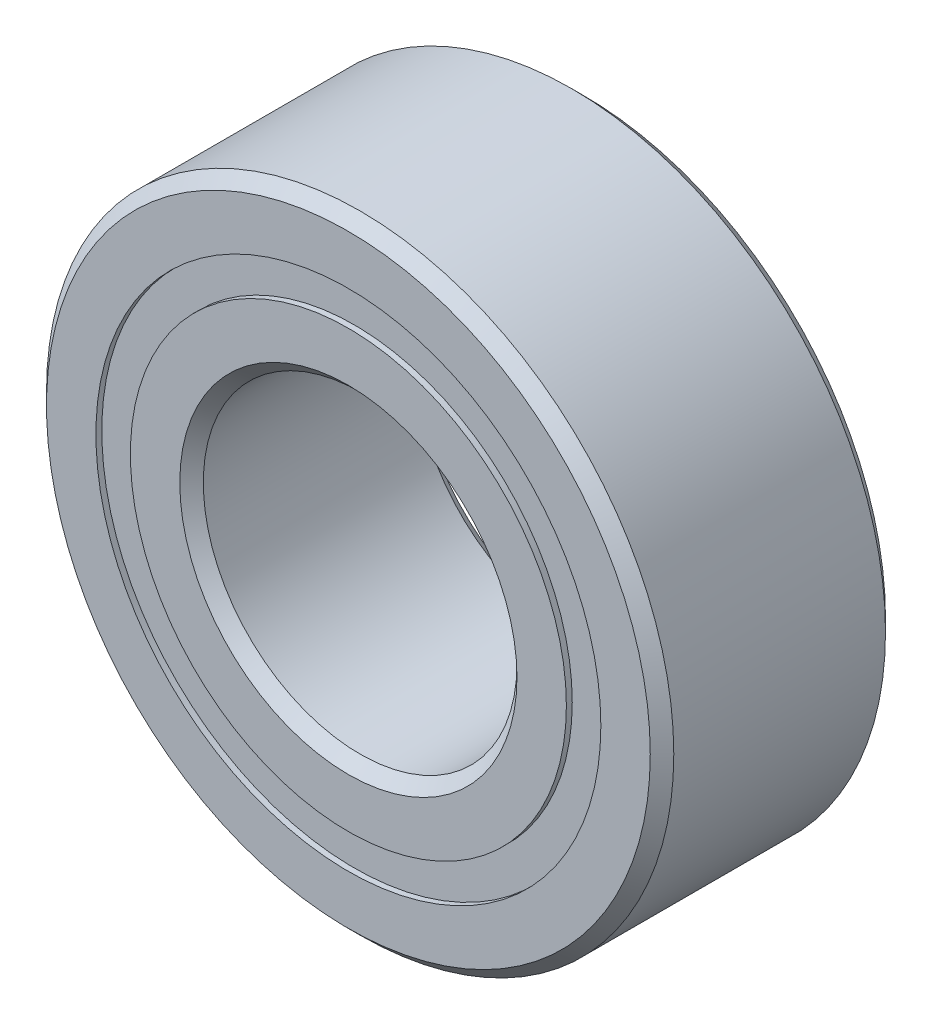
from build123d import *

# Parameters (mm, degrees)
CIRPATTERN1_COUNT = 12
SKETCH5_W         = 1.147826059
SKETCH5_H         = 0.697802198


with BuildPart() as part:
    # Sketch1 → Revolve1 (revolve)
    with BuildSketch(Plane(origin=(0, 0, 0), x_dir=(0, 0, -1), z_dir=(1, 0, 0))):
        with BuildLine():
            Line((2.143125, 6.35), (-2.143125, 6.35))
            Line((-2.143125, 6.35), (-2.38125, 6.111875))
            Line((-2.38125, 6.111875), (-2.38125, 5.111401099))
            Line((-2.38125, 5.111401099), (-1.058333333, 5.111401099))
            ThreePointArc((-1.058333333, 5.111401099), (0, 5.876861441), (1.058333333, 5.111401099))
            Line((1.058333333, 5.111401099), (2.38125, 5.111401099))
            Line((2.38125, 5.111401099), (2.38125, 6.111875))
            Line((2.38125, 6.111875), (2.143125, 6.35))
        make_face()
    revolve(axis=Axis((0, 0, 2.38125), (0, 0, -1)))


with BuildPart() as body_2:
    # Sketch3 → Revolve3 (revolve)
    with BuildSketch(Plane(origin=(0, 0, 0), x_dir=(0, 0, -1), z_dir=(1, 0, 0))):
        with BuildLine():
            Line((-1.058333333, 4.413598901), (-2.38125, 4.413598901))
            Line((-2.38125, 4.413598901), (-2.38125, 3.413125))
            Line((-2.38125, 3.413125), (-2.143125, 3.175))
            Line((-2.143125, 3.175), (2.143125, 3.175))
            Line((2.143125, 3.175), (2.38125, 3.413125))
            Line((2.38125, 3.413125), (2.38125, 4.413598901))
            Line((2.38125, 4.413598901), (1.058333333, 4.413598901))
            ThreePointArc((1.058333333, 4.413598901), (0, 3.648138559), (-1.058333333, 4.413598901))
        make_face()
    revolve(axis=Axis((0, 0, 2.38125), (0, 0, -1)))


with BuildPart() as body_3:
    # Sketch4 → Revolve4 (revolve)
    with BuildSketch(Plane(origin=(0, 0, 0), x_dir=(0, 0, -1), z_dir=(1, 0, 0))):
        with BuildLine():
            Line((-1.114361441, 4.7625), (1.114361441, 4.7625))
            ThreePointArc((1.114361441, 4.7625), (0, 5.876861441), (-1.114361441, 4.7625))
        make_face()
    revolve(axis=Axis((0, 4.7625, 1.114361441), (0, 0, -1)))


with BuildPart() as cirpattern1_1:
    # CirPattern1: pattern copy
    add(body_3.part.rotate(Axis((0, 0, -2.38125), (0, 0, 1)), 1 * 360 / CIRPATTERN1_COUNT))


with BuildPart() as cirpattern1_2:
    # CirPattern1: pattern copy
    add(body_3.part.rotate(Axis((0, 0, -2.38125), (0, 0, 1)), 2 * 360 / CIRPATTERN1_COUNT))


with BuildPart() as cirpattern1_3:
    # CirPattern1: pattern copy
    add(body_3.part.rotate(Axis((0, 0, -2.38125), (0, 0, 1)), 3 * 360 / CIRPATTERN1_COUNT))


with BuildPart() as cirpattern1_4:
    # CirPattern1: pattern copy
    add(body_3.part.rotate(Axis((0, 0, -2.38125), (0, 0, 1)), 4 * 360 / CIRPATTERN1_COUNT))


with BuildPart() as cirpattern1_5:
    # CirPattern1: pattern copy
    add(body_3.part.rotate(Axis((0, 0, -2.38125), (0, 0, 1)), 5 * 360 / CIRPATTERN1_COUNT))


with BuildPart() as cirpattern1_6:
    # CirPattern1: pattern copy
    add(body_3.part.rotate(Axis((0, 0, -2.38125), (0, 0, 1)), 6 * 360 / CIRPATTERN1_COUNT))


with BuildPart() as cirpattern1_7:
    # CirPattern1: pattern copy
    add(body_3.part.rotate(Axis((0, 0, -2.38125), (0, 0, 1)), 7 * 360 / CIRPATTERN1_COUNT))


with BuildPart() as cirpattern1_8:
    # CirPattern1: pattern copy
    add(body_3.part.rotate(Axis((0, 0, -2.38125), (0, 0, 1)), 8 * 360 / CIRPATTERN1_COUNT))


with BuildPart() as cirpattern1_9:
    # CirPattern1: pattern copy
    add(body_3.part.rotate(Axis((0, 0, -2.38125), (0, 0, 1)), 9 * 360 / CIRPATTERN1_COUNT))


with BuildPart() as cirpattern1_10:
    # CirPattern1: pattern copy
    add(body_3.part.rotate(Axis((0, 0, -2.38125), (0, 0, 1)), 10 * 360 / CIRPATTERN1_COUNT))


with BuildPart() as cirpattern1_11:
    # CirPattern1: pattern copy
    add(body_3.part.rotate(Axis((0, 0, -2.38125), (0, 0, 1)), 11 * 360 / CIRPATTERN1_COUNT))


with BuildPart() as body_15:
    # Sketch5 → Revolve5 (revolve)
    with BuildSketch(Plane(origin=(0, 0, 0), x_dir=(0, 0, -1), z_dir=(1, 0, 0))):
        with Locations((-1.688274471, 4.7625)):
            Rectangle(SKETCH5_W, SKETCH5_H)
        with Locations((1.688274471, 4.7625)):
            Rectangle(SKETCH5_W, SKETCH5_H)
    revolve(axis=Axis((0, 0, 2.38125), (0, 0, -1)))


solid = Compound([part.part, body_2.part, body_3.part, cirpattern1_1.part, cirpattern1_2.part, cirpattern1_3.part, cirpattern1_4.part, cirpattern1_5.part, cirpattern1_6.part, cirpattern1_7.part, cirpattern1_8.part, cirpattern1_9.part, cirpattern1_10.part, cirpattern1_11.part, body_15.part])
